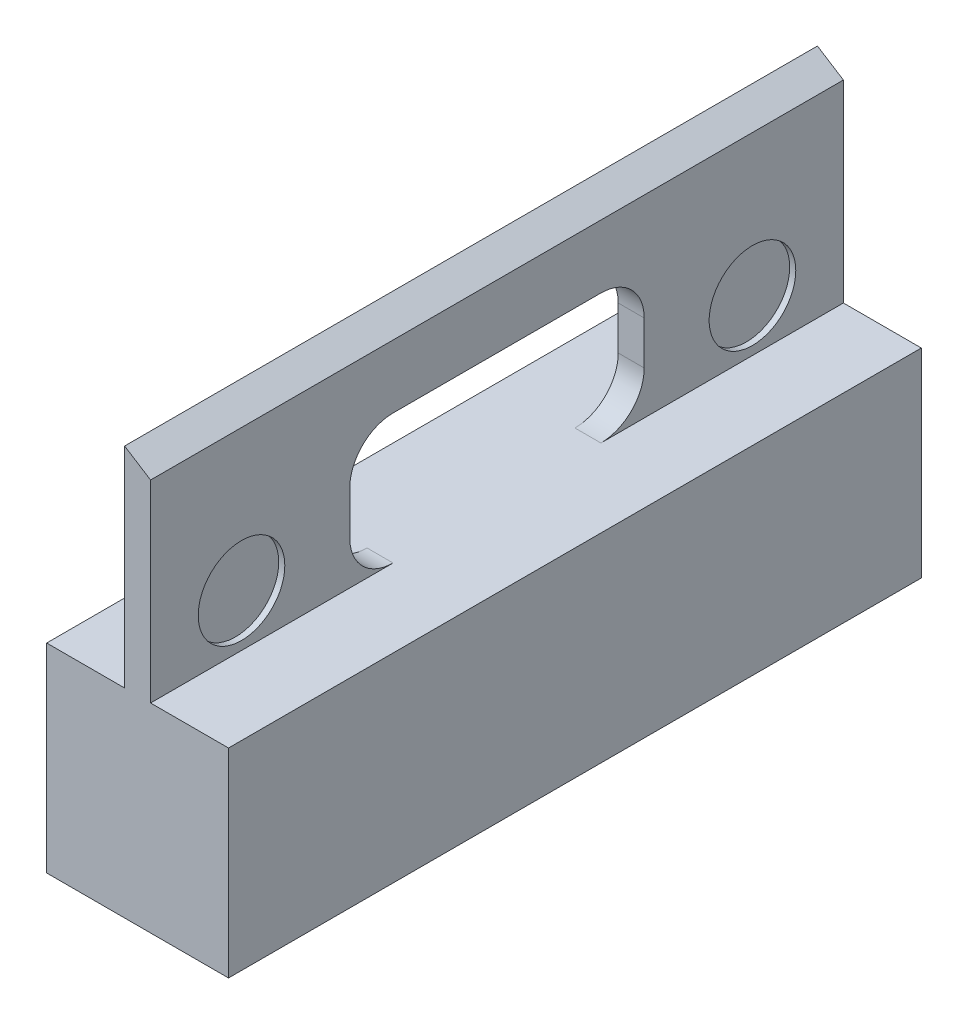
from build123d import *

# Parameters (mm, degrees)
BOSS_EXTRU_1_DEPTH      = 2
BOSS_EXTRU_1_DEPTH_BACK = 21
ESQUISSE1_W             = 21
ESQUISSE1_H             = 80
ESQUISSE10_W            = 3
ESQUISSE10_H            = 80
BOSS_EXTRU_2_DEPTH      = 24.2
ESQUISSE11_W            = 34
ESQUISSE11_H            = 15
ENL_V_MAT_EXTRU_1_DEPTH = 3
CONG_1_R                = 5
ENL_V_MAT_EXTRU_2_DEPTH = 81
COQUE2_START            = -21
COQUE2_OUTLINE_W        = 17
COQUE2_OUTLINE_H        = 76
COQUE2_DEPTH            = 21
ESQUISSE15_W            = 16
ESQUISSE15_H            = 10
ENL_V_MAT_EXTRU_3_DEPTH = 2
ESQUISSE12_R            = 5
ENL_V_MAT_EXTRU_4_DEPTH = 0.7


# Read off the part's stored shape, not the designer's step: Coque2
with BuildPart() as part:
    # Esquisse1 → Boss.-Extru.1 (new, two sides: drawn at the far end of the back side and taken through both)
    with BuildSketch(Plane(origin=(0, 0, 0), x_dir=(1, 0, 0), z_dir=(0, 1, 0)).offset(-BOSS_EXTRU_1_DEPTH_BACK)):
        with Locations((-10.5, -40)):
            Rectangle(ESQUISSE1_W, ESQUISSE1_H)
    extrude(amount=BOSS_EXTRU_1_DEPTH + BOSS_EXTRU_1_DEPTH_BACK)

    # Esquisse10 → Boss.-Extru.2 (add)
    with BuildSketch(Plane(origin=(0, 2, 0), x_dir=(1, 0, 0), z_dir=(0, 1, 0))):
        with Locations((-10.5, -40)):
            Rectangle(ESQUISSE10_W, ESQUISSE10_H)
    extrude(amount=BOSS_EXTRU_2_DEPTH)

    # Esquisse11 → Enlèv. mat.-Extru.1 (cut)
    with BuildSketch(Plane.ZY.offset(12)):
        with Locations((40, 9.5)):
            Rectangle(ESQUISSE11_W, ESQUISSE11_H)
    extrude(amount=-ENL_V_MAT_EXTRU_1_DEPTH, mode=Mode.SUBTRACT)

    # Congé1
    cong_1_edges = [part.edges().sort_by_distance(p)[0] for p in [
        (-10.5, 17, 57),
        (-10.5, 2, 57),
        (-10.5, 2, 23),
        (-10.5, 17, 23),
    ]]
    fillet(cong_1_edges, radius=CONG_1_R)

    # Esquisse13 → Enlèv. mat.-Extru.2 (cut)
    with BuildSketch(Plane.XY.offset(80)):
        Polygon((-12, 26.2), (-9, 26.2), (-9, 24.3), align=None)
    extrude(amount=-ENL_V_MAT_EXTRU_2_DEPTH, mode=Mode.SUBTRACT)

    # Coque2 outline → Coque2 (cut)
    with BuildSketch(Plane(origin=(0, 0, 0), x_dir=(1, 0, 0), z_dir=(0, 1, 0)).offset(COQUE2_START)):
        with Locations((-10.5, -40)):
            Rectangle(COQUE2_OUTLINE_W, COQUE2_OUTLINE_H)
    extrude(amount=COQUE2_DEPTH, mode=Mode.SUBTRACT)

    # Esquisse15 → Enlèv. mat.-Extru.3 (cut)
    with BuildSketch(Plane.ZY.offset(21)):
        with Locations((40, -16)):
            Rectangle(ESQUISSE15_W, ESQUISSE15_H)
    extrude(amount=-ENL_V_MAT_EXTRU_3_DEPTH, mode=Mode.SUBTRACT)

    # Esquisse12 → Enlèv. mat.-Extru.4 (cut)
    with BuildSketch(Plane(origin=(-9, 0, 0), x_dir=(0, 0, -1), z_dir=(1, 0, 0))):
        with Locations((-69.5, 8)):
            Circle(ESQUISSE12_R)
        with Locations((-10.5, 8)):
            Circle(ESQUISSE12_R)
    extrude(amount=-ENL_V_MAT_EXTRU_4_DEPTH, mode=Mode.SUBTRACT)


solid = part.part
